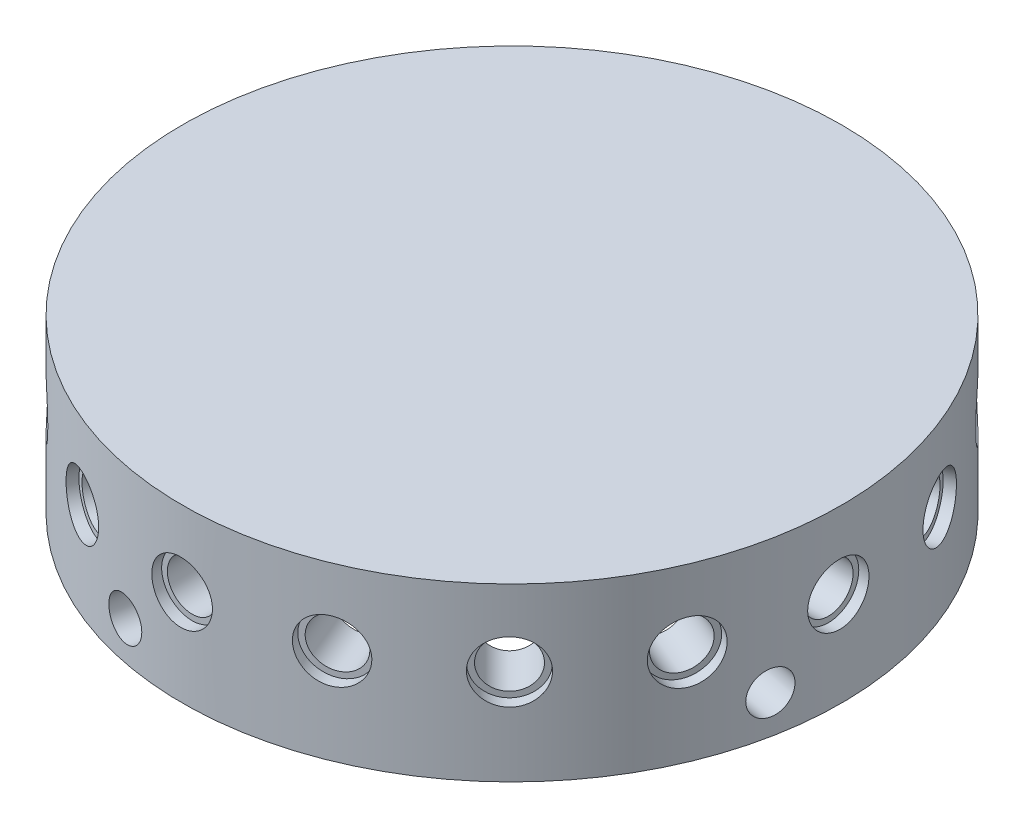
from build123d import *

# Parameters (mm, degrees)
SZKIC2_R                   = 8
SZKIC2_R_2                 = 6.5
WYTNIJ_WYCI_GNI_CIE2_DEPTH = 3
SZKIC3_R                   = 6.5
WYTNIJ_WYCI_GNI_CIE3_DEPTH = 30
SZYK_KO_OWY1_COUNT         = 16
WYTNIJ_WYCI_GNI_CIE4_REACH = 214.28
SZKIC6_R                   = 5.5
SZYK_KO_OWY2_COUNT         = 4


with BuildPart() as part:
    # Szkic1 → Obrót1 (revolve)
    with BuildSketch(Plane.XY):
        Polygon((0, 70.848451872), (-86.5, 70.848451872), (-86.5, 40.848451872), (-86.5, 25.848451872), (-70.5, 25.848451872), (-70.5, 65.848451872), (0, 65.848451872), align=None)
    revolve(axis=Axis((0, -200.62943078, 0), (0, 1, 0)))

    # Szkic2 → Wytnij-wyciągnięcie2 (cut)
    with BuildSketch(Plane(origin=(86.5, 0, 0), x_dir=(0, 0, -1), z_dir=(1, 0, 0))):
        with Locations((-0.467069002, 50.848451872)):
            Circle(SZKIC2_R)
        with Locations((-0.467069002, 50.848451872)):
            Circle(SZKIC2_R_2, mode=Mode.SUBTRACT)
    wytnij_wyci_gni_cie2 = extrude(amount=-WYTNIJ_WYCI_GNI_CIE2_DEPTH, mode=Mode.SUBTRACT)

    # Szkic3 → Wytnij-wyciągnięcie3 (cut)
    with BuildSketch(Plane(origin=(86.5, 0, 0), x_dir=(0, 0, -1), z_dir=(1, 0, 0))):
        with Locations((-0.467069002, 50.848451872)):
            Circle(SZKIC3_R)
    wytnij_wyci_gni_cie3 = extrude(amount=-WYTNIJ_WYCI_GNI_CIE3_DEPTH, mode=Mode.SUBTRACT)

    # Szyk kołowy1: Wytnij-wyciągnięcie2, Wytnij-wyciągnięcie3 ×16 about axis
    szyk_ko_owy1_axis = Axis((0, 0, 0), (0, -1, 0))
    add([wytnij_wyci_gni_cie2.rotate(szyk_ko_owy1_axis, i * 360 / SZYK_KO_OWY1_COUNT) for i in range(1, SZYK_KO_OWY1_COUNT)], mode=Mode.SUBTRACT)
    add([wytnij_wyci_gni_cie3.rotate(szyk_ko_owy1_axis, i * 360 / SZYK_KO_OWY1_COUNT) for i in range(1, SZYK_KO_OWY1_COUNT)], mode=Mode.SUBTRACT)

    # Szkic6 → Wytnij-wyciągnięcie4 (cut, up to next)
    with BuildSketch(Plane(origin=(-16.875312854, 0, 84.837926755), x_dir=(0, -1, 0), z_dir=(-0.19509032201613213, 0, 0.9807852804032297)), mode=Mode.PRIVATE) as wytnij_wyci_gni_cie4_sk1:
        with Locations((-35.848451872, 0)):
            Circle(SZKIC6_R)
    wytnij_wyci_gni_cie4_tool1 = extrude(wytnij_wyci_gni_cie4_sk1.sketch, amount=-WYTNIJ_WYCI_GNI_CIE4_REACH, mode=Mode.PRIVATE) & part.part
    wytnij_wyci_gni_cie4 = wytnij_wyci_gni_cie4_tool1.solids().sort_by_distance((-16.875313, 35.848452, 84.837927))[0]
    add(wytnij_wyci_gni_cie4, mode=Mode.SUBTRACT)

    # Szyk kołowy2: Wytnij-wyciągnięcie4 ×4 about axis
    szyk_ko_owy2_axis = Axis((0, -200.62943078, 0), (0, -1, 0))
    for i in range(1, SZYK_KO_OWY2_COUNT):
        add(wytnij_wyci_gni_cie4.rotate(szyk_ko_owy2_axis, i * 360 / SZYK_KO_OWY2_COUNT), mode=Mode.SUBTRACT)


solid = part.part
